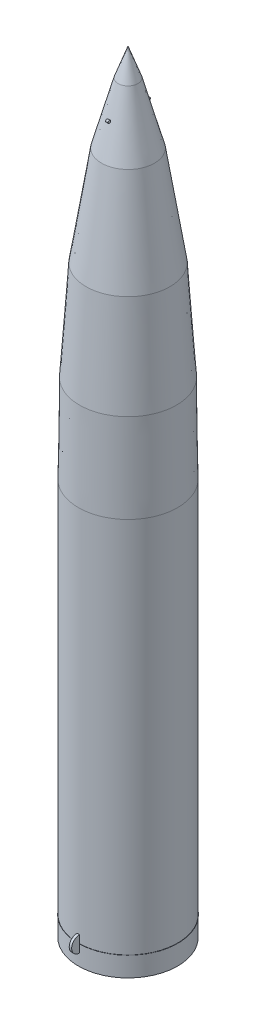
from build123d import *

# Parameters (mm, degrees)
SKETCH2_R                 = 10
BOSS_EXTRUDE4_START       = -110
BOSS_EXTRUDE4_OUTLINE_R   = 120
BOSS_EXTRUDE4_DEPTH       = 220
BOSS_EXTRUDE4_2_OUTLINE_R = 120
BOSS_EXTRUDE4_2_DEPTH     = 220
BOSS_EXTRUDE4_3_OUTLINE_R = 20
BOSS_EXTRUDE4_3_DEPTH     = 220
BOSS_EXTRUDE4_4_OUTLINE_R = 20
BOSS_EXTRUDE4_4_DEPTH     = 220
SKETCH7_W                 = 270
SKETCH7_H                 = 6000
BOSS_EXTRUDE5_DEPTH       = 425


with BuildPart() as part:
    # Sketch1 → Revolve1 (revolve)
    with BuildSketch(Plane.XY, mode=Mode.PRIVATE) as revolve1_sk:
        Polygon((0, 150000), (900, 147500), (2400, 142000), (3800, 133000), (4400, 124000), (4500, 116000), (4500, 80000), (4320, 80000), (4320, 116000), (0, 122000), align=None)
    revolve(revolve1_sk.sketch.rotate(Axis((0, 80000, 0), (0, 1, 0)), 90), axis=Axis((0, 80000, 0), (0, 1, 0)))

    # Sketch2 → Revolve2 (revolve)
    with BuildSketch(Plane.XY, mode=Mode.PRIVATE) as revolve2_sk:
        with Locations((4506, 81800)):
            Circle(SKETCH2_R)
    revolve(revolve2_sk.sketch.rotate(Axis((0, 80000, 0), (0, 1, 0)), 90), axis=Axis((0, 80000, 0), (0, 1, 0)))

    # Sketch4 → Revolve3 (revolve)
    with BuildSketch(Plane.XY, mode=Mode.PRIVATE) as revolve3_sk:
        Polygon((0, 83500), (0, 80000), (580, 80000), align=None)
        Polygon((2200, 83500), (4500, 80000), (3700, 79600), align=None)
    revolve(revolve3_sk.sketch.rotate(Axis((0, 78000, 0), (0, 1, 0)), 90), axis=Axis((0, 78000, 0), (0, 1, 0)))


with BuildPart() as revolve3_piece_1:
    # of the separate pieces the step leaves, piece 1, a body of its own (revolve3_pieces)
    add(part.part.solids().sort_by_distance((0, 150000, 0))[0])

    # Boss-Extrude4 5: loft between two sections, ruled curve by curve
    boss_extrude4_5_from = [
        Edge.make_three_point_arc((110, 82505.469961567, 4320.000964692), (110, 81808, 3779.677849848), (110, 81110.530038433, 4320.000964692)),
        Edge.make_line((110, 81110.530038433, 4320.000964692), (110, 82505.469961567, 4320.000964692)),
    ]
    boss_extrude4_5_to = [
        Edge.make_three_point_arc((-110, 82505.469961567, 4320.000964692), (-110, 81808, 3779.677849848), (-110, 81110.530038433, 4320.000964692)),
        Edge.make_line((-110, 81110.530038433, 4320.000964692), (-110, 82505.469961567, 4320.000964692)),
    ]
    boss_extrude4_5 = Solid(Shell([*[Face.make_surface_from_curves(boss_extrude4_5_from[k], boss_extrude4_5_to[k]) for k in range(2)], Face(Wire(boss_extrude4_5_from)), Face(Wire(boss_extrude4_5_to))]))
    add(boss_extrude4_5)

    # Boss-Extrude4 6: loft between two sections, ruled curve by curve
    boss_extrude4_6_from = [
        Edge.make_three_point_arc((110, 81087.679104892, 4498.655354659), (110, 81298.180140724, 5008.869051022), (110, 81808, 5220.322150152)),
        Edge.make_three_point_arc((110, 81808, 5220.322150152), (110, 82317.819859276, 5008.869051022), (110, 82528.320895108, 4498.655354659)),
        Edge.make_line((110, 82528.320895108, 4498.655354659), (110, 81087.679104892, 4498.655354659)),
    ]
    boss_extrude4_6_to = [
        Edge.make_three_point_arc((-110, 81087.679104892, 4498.655354659), (-110, 81298.180140724, 5008.869051022), (-110, 81808, 5220.322150152)),
        Edge.make_three_point_arc((-110, 81808, 5220.322150152), (-110, 82317.819859276, 5008.869051022), (-110, 82528.320895108, 4498.655354659)),
        Edge.make_line((-110, 82528.320895108, 4498.655354659), (-110, 81087.679104892, 4498.655354659)),
    ]
    boss_extrude4_6 = Solid(Shell([*[Face.make_surface_from_curves(boss_extrude4_6_from[k], boss_extrude4_6_to[k]) for k in range(3)], Face(Wire(boss_extrude4_6_from)), Face(Wire(boss_extrude4_6_to))]))
    add(boss_extrude4_6)


with BuildPart() as revolve3_piece_2:
    # of the separate pieces the step leaves, piece 2, a body of its own (revolve3_pieces)
    add(part.part.solids().sort_by_distance((0, 80000, -580))[0])


with BuildPart() as body_3:
    # Boss-Extrude4: read off the stored shape, not the designer's step
    # Boss-Extrude4 outline → Boss-Extrude4 (new body)
    with BuildSketch(Plane(origin=(0, 0, 0), x_dir=(0, 0, -1), z_dir=(1, 0, 0)).offset(BOSS_EXTRUDE4_START)):
        with Locations((-1800, 145000)):
            Circle(BOSS_EXTRUDE4_OUTLINE_R)
    extrude(amount=BOSS_EXTRUDE4_DEPTH)


with BuildPart() as body_4:
    # Boss-Extrude4 2 outline → Boss-Extrude4 2 (new body)
    with BuildSketch(Plane(origin=(0, 0, 0), x_dir=(0, 0, -1), z_dir=(1, 0, 0)).offset(BOSS_EXTRUDE4_START)):
        with Locations((1800, 145000)):
            Circle(BOSS_EXTRUDE4_2_OUTLINE_R)
    extrude(amount=BOSS_EXTRUDE4_2_DEPTH)


with BuildPart() as body_5:
    # Boss-Extrude4 3 outline → Boss-Extrude4 3 (new body)
    with BuildSketch(Plane(origin=(0, 0, 0), x_dir=(0, 0, -1), z_dir=(1, 0, 0)).offset(BOSS_EXTRUDE4_START)):
        with Locations((4520, 84500)):
            Circle(BOSS_EXTRUDE4_3_OUTLINE_R)
    extrude(amount=BOSS_EXTRUDE4_3_DEPTH)


with BuildPart() as body_6:
    # Boss-Extrude4 4 outline → Boss-Extrude4 4 (new body)
    with BuildSketch(Plane(origin=(0, 0, 0), x_dir=(0, 0, -1), z_dir=(1, 0, 0)).offset(BOSS_EXTRUDE4_START)):
        with Locations((4520, 82500)):
            Circle(BOSS_EXTRUDE4_4_OUTLINE_R)
    extrude(amount=BOSS_EXTRUDE4_4_DEPTH)


with BuildPart() as body_7:
    # Sketch7 → Boss-Extrude5 (new, symmetric)
    with BuildSketch(Plane(origin=(0, 0, 0), x_dir=(0, 0, -1), z_dir=(1, 0, 0))):
        with Locations((4515, 129000)):
            Rectangle(SKETCH7_W, SKETCH7_H)
    extrude(amount=BOSS_EXTRUDE5_DEPTH, both=True)


solid = Compound([revolve3_piece_1.part, revolve3_piece_2.part, body_3.part, body_4.part, body_5.part, body_6.part, body_7.part])
